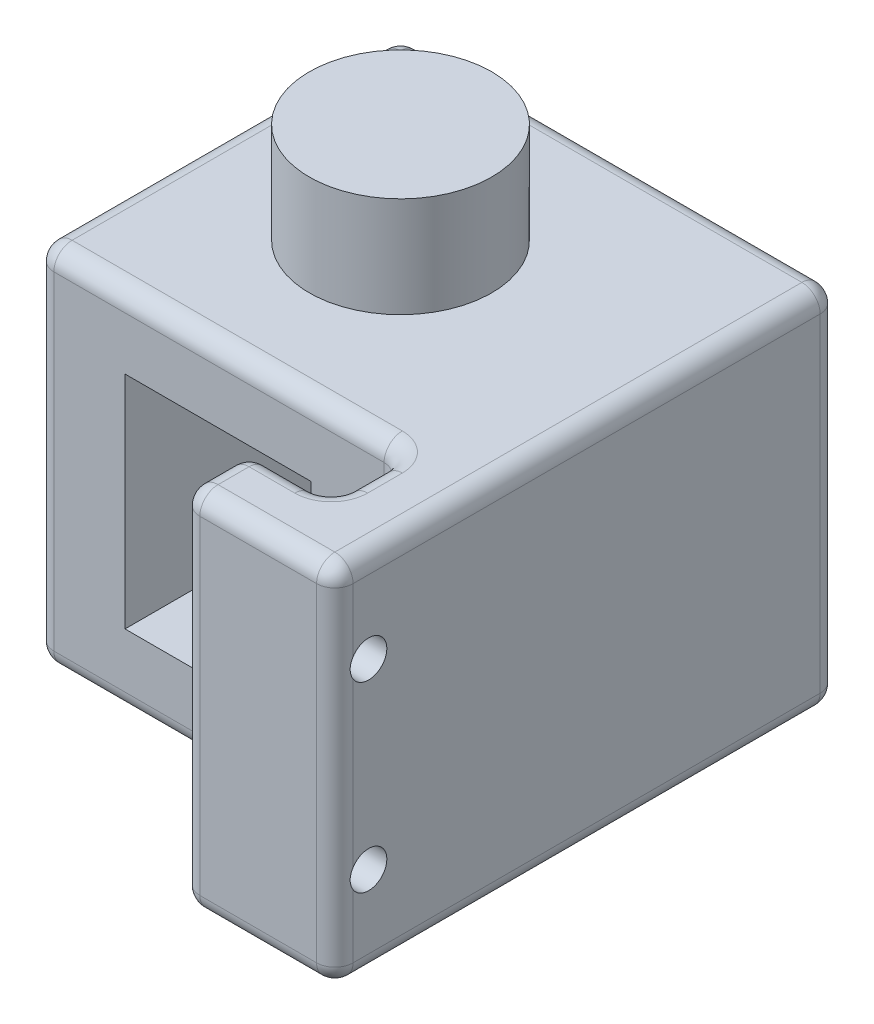
from build123d import *

# Parameters (mm, degrees)
EXTRUDE_1_DEPTH     = 10
SKETCH_3_R          = 5
EXTRUDE_2_DEPTH     = 15.5
SKETCH_2_W          = 10.2
SKETCH_2_H          = 12.1
CUT_EXTRUDE_1_DEPTH = 40.724174
SKETCH_4_R          = 1
CUT_EXTRUDE_2_DEPTH = 36.289800226
FILLET_1_R          = 1


with BuildPart() as part:
    # 草图1 → 凸台-拉伸1 (new, symmetric)
    with BuildSketch(Plane(origin=(0, 0, 0), x_dir=(1, 0, 0), z_dir=(0, 1, 0))):
        Polygon((0, 0), (24, 0), (24, -27.6), (15.6, -27.6), (15.6, -23.9), (20.1, -23.9), (20.1, -20), (0, -20), align=None)
    extrude(amount=EXTRUDE_1_DEPTH, both=True)

    # 草图3 → 凸台-拉伸2 (add, symmetric)
    with BuildSketch(Plane(origin=(0, 0, 0), x_dir=(1, 0, 0), z_dir=(0, 1, 0))):
        with Locations(Location((10, -10, 0), (0, 0, 90))):
            Circle(SKETCH_3_R)
    extrude(amount=EXTRUDE_2_DEPTH, both=True)

    # 草图2 → 切除-拉伸1 (cut, through all)
    with BuildSketch(Plane(origin=(0, 0, 0), x_dir=(-1, 0, 0), z_dir=(0, 0, -1))):
        with Locations((-10, 0.05)):
            Rectangle(SKETCH_2_W, SKETCH_2_H)
    extrude(amount=-CUT_EXTRUDE_1_DEPTH, mode=Mode.SUBTRACT)

    # 草图4 → 切除-拉伸2 (cut, through all)
    with BuildSketch(Plane.ZY.offset(-15.6)):
        with Locations((25.75, 5)):
            Circle(SKETCH_4_R)
        with Locations((25.75, -5)):
            Circle(SKETCH_4_R)
    extrude(amount=-CUT_EXTRUDE_2_DEPTH, mode=Mode.SUBTRACT)

    # 圆角1
    # the kernel refuses this fillet: 1 mm, written as the material it adds along each edge
    with BuildSketch(Plane(origin=(20.1, 10, 23.9), x_dir=(0, 0, -1), z_dir=(0, -1, 0))) as fillet_1_piece_1:
        with BuildLine():
            CenterArc((FILLET_1_R, -FILLET_1_R), FILLET_1_R, 90, 90)
            Line((0, -FILLET_1_R), (0, 0))
            Line((0, 0), (FILLET_1_R, 0))
        make_face()
    extrude(amount=20)
    with BuildSketch(Plane(origin=(20.1, -10, 20), x_dir=(-1, 0, 0), z_dir=(0, 1, 0))) as fillet_1_piece_2:
        with BuildLine():
            CenterArc((FILLET_1_R, FILLET_1_R), FILLET_1_R, 180, 90)
            Line((0, FILLET_1_R), (0, 0))
            Line((0, 0), (FILLET_1_R, 0))
        make_face()
    extrude(amount=20)
    # the kernel refuses this fillet: 1 mm, written as the material it takes off along each edge
    with BuildSketch(Plane(origin=(1, -9, 1), x_dir=(-1, 0, 0), z_dir=(0, 0, -1))) as fillet_1_2_piece_1_section:
        Polygon((0, 0), (FILLET_1_R, 0), (FILLET_1_R, -FILLET_1_R), (0, -FILLET_1_R), align=None)
    fillet_1_2_piece_1 = extrude(amount=FILLET_1_R, mode=Mode.PRIVATE)
    fillet_1_2_piece_1 = fillet_1_2_piece_1 - Plane(origin=(1, -9, 1), x_dir=(0.7071067811865475, 0.7071067811865475, 0), z_dir=(0, 0, -1)) * Sphere(FILLET_1_R, mode=Mode.PRIVATE)
    add(fillet_1_2_piece_1, mode=Mode.SUBTRACT)
    with BuildSketch(Plane(origin=(1, 9, 1), x_dir=(-1, 0, 0), z_dir=(0, 0, -1))) as fillet_1_2_piece_2_section:
        Polygon((0, 0), (FILLET_1_R, 0), (FILLET_1_R, FILLET_1_R), (0, FILLET_1_R), align=None)
    fillet_1_2_piece_2 = extrude(amount=FILLET_1_R, mode=Mode.PRIVATE)
    fillet_1_2_piece_2 = fillet_1_2_piece_2 - Plane(origin=(1, 9, 1), x_dir=(0.7071067811865475, -0.7071067811865475, 0), z_dir=(0, 0, -1)) * Sphere(FILLET_1_R, mode=Mode.PRIVATE)
    add(fillet_1_2_piece_2, mode=Mode.SUBTRACT)
    with BuildSketch(Plane(origin=(23, 9, 1), x_dir=(0, 1, 0), z_dir=(0, 0, -1))) as fillet_1_2_piece_3_section:
        Polygon((0, 0), (FILLET_1_R, 0), (FILLET_1_R, FILLET_1_R), (0, FILLET_1_R), align=None)
    fillet_1_2_piece_3 = extrude(amount=FILLET_1_R, mode=Mode.PRIVATE)
    fillet_1_2_piece_3 = fillet_1_2_piece_3 - Plane(origin=(23, 9, 1), x_dir=(-0.7071067811865475, -0.7071067811865475, 0), z_dir=(0, 0, -1)) * Sphere(FILLET_1_R, mode=Mode.PRIVATE)
    add(fillet_1_2_piece_3, mode=Mode.SUBTRACT)
    with BuildSketch(Plane(origin=(23, -9, 1), x_dir=(0, -1, 0), z_dir=(0, 0, -1))) as fillet_1_2_piece_4_section:
        Polygon((0, 0), (FILLET_1_R, 0), (FILLET_1_R, -FILLET_1_R), (0, -FILLET_1_R), align=None)
    fillet_1_2_piece_4 = extrude(amount=FILLET_1_R, mode=Mode.PRIVATE)
    fillet_1_2_piece_4 = fillet_1_2_piece_4 - Plane(origin=(23, -9, 1), x_dir=(-0.7071067811865475, 0.7071067811865475, 0), z_dir=(0, 0, -1)) * Sphere(FILLET_1_R, mode=Mode.PRIVATE)
    add(fillet_1_2_piece_4, mode=Mode.SUBTRACT)
    with BuildSketch(Plane(origin=(23, 9, 26.6), x_dir=(0, 1, 0), z_dir=(0, 0, 1))) as fillet_1_2_piece_5_section:
        Polygon((0, 0), (FILLET_1_R, 0), (FILLET_1_R, -FILLET_1_R), (0, -FILLET_1_R), align=None)
    fillet_1_2_piece_5 = extrude(amount=FILLET_1_R, mode=Mode.PRIVATE)
    fillet_1_2_piece_5 = fillet_1_2_piece_5 - Plane(origin=(23, 9, 26.6), x_dir=(-0.7071067811865475, -0.7071067811865475, 0), z_dir=(0, 0, 1)) * Sphere(FILLET_1_R, mode=Mode.PRIVATE)
    add(fillet_1_2_piece_5, mode=Mode.SUBTRACT)
    with BuildSketch(Plane(origin=(23, -9, 26.6), x_dir=(0, -1, 0), z_dir=(0, 0, 1))) as fillet_1_2_piece_6_section:
        Polygon((0, 0), (FILLET_1_R, 0), (FILLET_1_R, FILLET_1_R), (0, FILLET_1_R), align=None)
    fillet_1_2_piece_6 = extrude(amount=FILLET_1_R, mode=Mode.PRIVATE)
    fillet_1_2_piece_6 = fillet_1_2_piece_6 - Plane(origin=(23, -9, 26.6), x_dir=(-0.7071067811865475, 0.7071067811865475, 0), z_dir=(0, 0, 1)) * Sphere(FILLET_1_R, mode=Mode.PRIVATE)
    add(fillet_1_2_piece_6, mode=Mode.SUBTRACT)
    with BuildSketch(Plane(origin=(16.6, 9, 26.6), x_dir=(0, 1, 0), z_dir=(0, 0, 1))) as fillet_1_2_piece_7_section:
        Polygon((0, 0), (FILLET_1_R, 0), (FILLET_1_R, FILLET_1_R), (0, FILLET_1_R), align=None)
    fillet_1_2_piece_7 = extrude(amount=FILLET_1_R, mode=Mode.PRIVATE)
    fillet_1_2_piece_7 = fillet_1_2_piece_7 - Plane(origin=(16.6, 9, 26.6), x_dir=(0.7071067811865475, -0.7071067811865475, 0), z_dir=(0, 0, 1)) * Sphere(FILLET_1_R, mode=Mode.PRIVATE)
    add(fillet_1_2_piece_7, mode=Mode.SUBTRACT)
    with BuildSketch(Plane(origin=(16.6, -9, 26.6), x_dir=(0, -1, 0), z_dir=(0, 0, 1))) as fillet_1_2_piece_8_section:
        Polygon((0, 0), (FILLET_1_R, 0), (FILLET_1_R, -FILLET_1_R), (0, -FILLET_1_R), align=None)
    fillet_1_2_piece_8 = extrude(amount=FILLET_1_R, mode=Mode.PRIVATE)
    fillet_1_2_piece_8 = fillet_1_2_piece_8 - Plane(origin=(16.6, -9, 26.6), x_dir=(0.7071067811865475, 0.7071067811865475, 0), z_dir=(0, 0, 1)) * Sphere(FILLET_1_R, mode=Mode.PRIVATE)
    add(fillet_1_2_piece_8, mode=Mode.SUBTRACT)
    with BuildSketch(Plane(origin=(0, -10, 22.5), x_dir=(0, 1, 0), z_dir=(0, 0, -1))) as fillet_1_2_piece_9:
        with BuildLine():
            CenterArc((FILLET_1_R, FILLET_1_R), FILLET_1_R, 180, 90)
            Line((0, FILLET_1_R), (0, 0))
            Line((0, 0), (FILLET_1_R, 0))
        make_face()
    extrude(amount=21.5, mode=Mode.SUBTRACT)
    with BuildSketch(Plane(origin=(0, -9, 0), x_dir=(1, 0, 0), z_dir=(0, 1, 0)), Plane(origin=(24, 9, 0), x_dir=(-1, 0, 0), z_dir=(0, -1, 0)), Plane(origin=(24, 9, 27.6), x_dir=(0, 0, -1), z_dir=(0, -1, 0)), Plane(origin=(15.6, 9, 27.6), x_dir=(1, 0, 0), z_dir=(0, -1, 0))) as fillet_1_2_piece_10:
        with BuildLine():
            CenterArc((FILLET_1_R, -FILLET_1_R), FILLET_1_R, 90, 90)
            Line((0, -FILLET_1_R), (0, 0))
            Line((0, 0), (FILLET_1_R, 0))
        make_face()
    extrude(amount=18, mode=Mode.SUBTRACT)
    with BuildSketch(Plane(origin=(15.6, 12.5, 23.9), x_dir=(0, 0, 1), z_dir=(0, -1, 0)), Plane(origin=(0, -12.5, 20), x_dir=(0, 0, -1), z_dir=(0, 1, 0))) as fillet_1_2_piece_11:
        with BuildLine():
            CenterArc((FILLET_1_R, -FILLET_1_R), FILLET_1_R, 90, 90)
            Line((0, -FILLET_1_R), (0, 0))
            Line((0, 0), (FILLET_1_R, 0))
        make_face()
    extrude(amount=25, mode=Mode.SUBTRACT)
    with BuildSketch(Plane(origin=(15.6, 10, 26.6), x_dir=(1, 0, 0), z_dir=(0, 0, -1))) as fillet_1_2_piece_12:
        with BuildLine():
            CenterArc((FILLET_1_R, FILLET_1_R), FILLET_1_R, 180, 90)
            Line((0, FILLET_1_R), (0, 0))
            Line((0, 0), (FILLET_1_R, 0))
        make_face()
    extrude(amount=5.2, mode=Mode.SUBTRACT)
    with BuildSketch(Plane(origin=(23, 10, 27.6), x_dir=(0, 0, -1), z_dir=(-1, 0, 0))) as fillet_1_2_piece_13:
        with BuildLine():
            CenterArc((FILLET_1_R, FILLET_1_R), FILLET_1_R, 180, 90)
            Line((0, FILLET_1_R), (0, 0))
            Line((0, 0), (FILLET_1_R, 0))
        make_face()
    extrude(amount=6.4, mode=Mode.SUBTRACT)
    with BuildSketch(Plane(origin=(24, 10, 1), x_dir=(-1, 0, 0), z_dir=(0, 0, 1))) as fillet_1_2_piece_14:
        with BuildLine():
            CenterArc((FILLET_1_R, FILLET_1_R), FILLET_1_R, 180, 90)
            Line((0, FILLET_1_R), (0, 0))
            Line((0, 0), (FILLET_1_R, 0))
        make_face()
    extrude(amount=25.6, mode=Mode.SUBTRACT)
    with BuildSketch(Plane(origin=(1, 10, 0), x_dir=(0, -1, 0), z_dir=(1, 0, 0))) as fillet_1_2_piece_15:
        with BuildLine():
            CenterArc((FILLET_1_R, -FILLET_1_R), FILLET_1_R, 90, 90)
            Line((0, -FILLET_1_R), (0, 0))
            Line((0, 0), (FILLET_1_R, 0))
        make_face()
    extrude(amount=22, mode=Mode.SUBTRACT)
    with BuildSketch(Plane(origin=(0, 10, 22.5), x_dir=(0, -1, 0), z_dir=(0, 0, -1))) as fillet_1_2_piece_16:
        with BuildLine():
            CenterArc((FILLET_1_R, -FILLET_1_R), FILLET_1_R, 90, 90)
            Line((0, -FILLET_1_R), (0, 0))
            Line((0, 0), (FILLET_1_R, 0))
        make_face()
    extrude(amount=21.5, mode=Mode.SUBTRACT)
    with BuildSketch(Plane(origin=(1, -10, 0), x_dir=(0, 1, 0), z_dir=(1, 0, 0))) as fillet_1_2_piece_17:
        with BuildLine():
            CenterArc((FILLET_1_R, FILLET_1_R), FILLET_1_R, 180, 90)
            Line((0, FILLET_1_R), (0, 0))
            Line((0, 0), (FILLET_1_R, 0))
        make_face()
    extrude(amount=22, mode=Mode.SUBTRACT)
    with BuildSketch(Plane(origin=(24, -10, 1), x_dir=(-1, 0, 0), z_dir=(0, 0, 1))) as fillet_1_2_piece_18:
        with BuildLine():
            CenterArc((FILLET_1_R, -FILLET_1_R), FILLET_1_R, 90, 90)
            Line((0, -FILLET_1_R), (0, 0))
            Line((0, 0), (FILLET_1_R, 0))
        make_face()
    extrude(amount=25.6, mode=Mode.SUBTRACT)
    with BuildSketch(Plane(origin=(23, -10, 27.6), x_dir=(0, 0, -1), z_dir=(-1, 0, 0))) as fillet_1_2_piece_19:
        with BuildLine():
            CenterArc((FILLET_1_R, -FILLET_1_R), FILLET_1_R, 90, 90)
            Line((0, -FILLET_1_R), (0, 0))
            Line((0, 0), (FILLET_1_R, 0))
        make_face()
    extrude(amount=6.4, mode=Mode.SUBTRACT)
    with BuildSketch(Plane(origin=(15.6, -10, 26.6), x_dir=(1, 0, 0), z_dir=(0, 0, -1))) as fillet_1_2_piece_20:
        with BuildLine():
            CenterArc((FILLET_1_R, -FILLET_1_R), FILLET_1_R, 90, 90)
            Line((0, -FILLET_1_R), (0, 0))
            Line((0, 0), (FILLET_1_R, 0))
        make_face()
    extrude(amount=5.2, mode=Mode.SUBTRACT)
    # the kernel refuses this fillet: 1 mm, written as the material it takes off along each edge
    with BuildSketch(Plane(origin=(1, 9, 19), x_dir=(0, 0, 1), z_dir=(0, 1, 0))) as fillet_1_3_piece_1_section:
        Polygon((0, 0), (FILLET_1_R, 0), (FILLET_1_R, -FILLET_1_R), (0, -FILLET_1_R), align=None)
    fillet_1_3_piece_1 = extrude(amount=FILLET_1_R, mode=Mode.PRIVATE)
    fillet_1_3_piece_1 = fillet_1_3_piece_1 - Plane(origin=(1, 9, 19), x_dir=(0.7071067811865475, 0, -0.7071067811865476), z_dir=(0, 1, 0)) * Sphere(FILLET_1_R, mode=Mode.PRIVATE)
    add(fillet_1_3_piece_1, mode=Mode.SUBTRACT)
    with BuildSketch(Plane(origin=(16.6, 9, 24.9), x_dir=(0, 0, -1), z_dir=(0, 1, 0))) as fillet_1_3_piece_2_section:
        Polygon((0, 0), (FILLET_1_R, 0), (FILLET_1_R, FILLET_1_R), (0, FILLET_1_R), align=None)
    fillet_1_3_piece_2 = extrude(amount=FILLET_1_R, mode=Mode.PRIVATE)
    fillet_1_3_piece_2 = fillet_1_3_piece_2 - Plane(origin=(16.6, 9, 24.9), x_dir=(0.7071067811865475, 0, 0.7071067811865475), z_dir=(0, 1, 0)) * Sphere(FILLET_1_R, mode=Mode.PRIVATE)
    add(fillet_1_3_piece_2, mode=Mode.SUBTRACT)
    with BuildSketch(Plane(origin=(1, -9, 19), x_dir=(0, 0, 1), z_dir=(0, -1, 0))) as fillet_1_3_piece_3_section:
        Polygon((0, 0), (FILLET_1_R, 0), (FILLET_1_R, FILLET_1_R), (0, FILLET_1_R), align=None)
    fillet_1_3_piece_3 = extrude(amount=FILLET_1_R, mode=Mode.PRIVATE)
    fillet_1_3_piece_3 = fillet_1_3_piece_3 - Plane(origin=(1, -9, 19), x_dir=(0.7071067811865475, 0, -0.7071067811865476), z_dir=(0, -1, 0)) * Sphere(FILLET_1_R, mode=Mode.PRIVATE)
    add(fillet_1_3_piece_3, mode=Mode.SUBTRACT)
    with BuildSketch(Plane(origin=(16.6, -9, 24.9), x_dir=(0, 0, -1), z_dir=(0, -1, 0))) as fillet_1_3_piece_4_section:
        Polygon((0, 0), (FILLET_1_R, 0), (FILLET_1_R, -FILLET_1_R), (0, -FILLET_1_R), align=None)
    fillet_1_3_piece_4 = extrude(amount=FILLET_1_R, mode=Mode.PRIVATE)
    fillet_1_3_piece_4 = fillet_1_3_piece_4 - Plane(origin=(16.6, -9, 24.9), x_dir=(0.7071067811865475, 0, 0.7071067811865475), z_dir=(0, -1, 0)) * Sphere(FILLET_1_R, mode=Mode.PRIVATE)
    add(fillet_1_3_piece_4, mode=Mode.SUBTRACT)
    with BuildSketch(Plane(origin=(16.6, -10, 23.9), x_dir=(0, 0, 1), z_dir=(1, 0, 0))) as fillet_1_3_piece_5:
        with BuildLine():
            CenterArc((FILLET_1_R, -FILLET_1_R), FILLET_1_R, 90, 90)
            Line((0, -FILLET_1_R), (0, 0))
            Line((0, 0), (FILLET_1_R, 0))
        make_face()
    extrude(amount=2.5, mode=Mode.SUBTRACT)
    with BuildSketch(Plane(origin=(20.1, -10, 22.9), x_dir=(1, 0, 0), z_dir=(0, 0, -1))) as fillet_1_3_piece_6:
        with BuildLine():
            CenterArc((FILLET_1_R, -FILLET_1_R), FILLET_1_R, 90, 90)
            Line((0, -FILLET_1_R), (0, 0))
            Line((0, 0), (FILLET_1_R, 0))
        make_face()
    extrude(amount=1.9, mode=Mode.SUBTRACT)
    with BuildSketch(Plane(origin=(19.1, -10, 20), x_dir=(0, 0, -1), z_dir=(-1, 0, 0))) as fillet_1_3_piece_7:
        with BuildLine():
            CenterArc((FILLET_1_R, -FILLET_1_R), FILLET_1_R, 90, 90)
            Line((0, -FILLET_1_R), (0, 0))
            Line((0, 0), (FILLET_1_R, 0))
        make_face()
    extrude(amount=18.1, mode=Mode.SUBTRACT)
    with BuildSketch(Plane(origin=(20.1, 10, 22.9), x_dir=(1, 0, 0), z_dir=(0, 0, -1))) as fillet_1_3_piece_8:
        with BuildLine():
            CenterArc((FILLET_1_R, FILLET_1_R), FILLET_1_R, 180, 90)
            Line((0, FILLET_1_R), (0, 0))
            Line((0, 0), (FILLET_1_R, 0))
        make_face()
    extrude(amount=1.9, mode=Mode.SUBTRACT)
    with BuildSketch(Plane(origin=(16.6, 10, 23.9), x_dir=(0, 0, 1), z_dir=(1, 0, 0))) as fillet_1_3_piece_9:
        with BuildLine():
            CenterArc((FILLET_1_R, FILLET_1_R), FILLET_1_R, 180, 90)
            Line((0, FILLET_1_R), (0, 0))
            Line((0, 0), (FILLET_1_R, 0))
        make_face()
    extrude(amount=2.5, mode=Mode.SUBTRACT)
    with BuildSketch(Plane(origin=(19.1, 10, 20), x_dir=(0, 0, -1), z_dir=(-1, 0, 0))) as fillet_1_3_piece_10:
        with BuildLine():
            CenterArc((FILLET_1_R, FILLET_1_R), FILLET_1_R, 180, 90)
            Line((0, FILLET_1_R), (0, 0))
            Line((0, 0), (FILLET_1_R, 0))
        make_face()
    extrude(amount=18.1, mode=Mode.SUBTRACT)
    with BuildSketch(Plane(origin=(19.1, 10, 21), x_dir=(0, 0, -1), z_dir=(-1, 0, 0))) as fillet_1_3_piece_11:
        with BuildLine():
            CenterArc((1 + FILLET_1_R, FILLET_1_R), FILLET_1_R, 180, 90)
            Line((1, FILLET_1_R), (1, 0))
            Line((1, 0), (1 + FILLET_1_R, 0))
        make_face()
    revolve(axis=Axis((19.1, 10, 21), (0, -1, 0)), revolution_arc=90, mode=Mode.SUBTRACT)
    with BuildSketch(Plane(origin=(19.1, 10, 22.9), x_dir=(1, 0, 0), z_dir=(0, 0, -1))) as fillet_1_3_piece_12:
        with BuildLine():
            CenterArc((1 + FILLET_1_R, FILLET_1_R), FILLET_1_R, 180, 90)
            Line((1, FILLET_1_R), (1, 0))
            Line((1, 0), (1 + FILLET_1_R, 0))
        make_face()
    revolve(axis=Axis((19.1, 10, 22.9), (0, -1, 0)), revolution_arc=90, mode=Mode.SUBTRACT)
    with BuildSketch(Plane(origin=(19.1, -10, 21), x_dir=(0, 0, -1), z_dir=(-1, 0, 0))) as fillet_1_3_piece_13:
        with BuildLine():
            CenterArc((1 + FILLET_1_R, -FILLET_1_R), FILLET_1_R, 90, 90)
            Line((1, -FILLET_1_R), (1, 0))
            Line((1, 0), (1 + FILLET_1_R, 0))
        make_face()
    revolve(axis=Axis((19.1, -10, 21), (0, -1, 0)), revolution_arc=90, mode=Mode.SUBTRACT)
    with BuildSketch(Plane(origin=(19.1, -10, 22.9), x_dir=(1, 0, 0), z_dir=(0, 0, -1))) as fillet_1_3_piece_14:
        with BuildLine():
            CenterArc((1 + FILLET_1_R, -FILLET_1_R), FILLET_1_R, 90, 90)
            Line((1, -FILLET_1_R), (1, 0))
            Line((1, 0), (1 + FILLET_1_R, 0))
        make_face()
    revolve(axis=Axis((19.1, -10, 22.9), (0, -1, 0)), revolution_arc=90, mode=Mode.SUBTRACT)


solid = part.part
